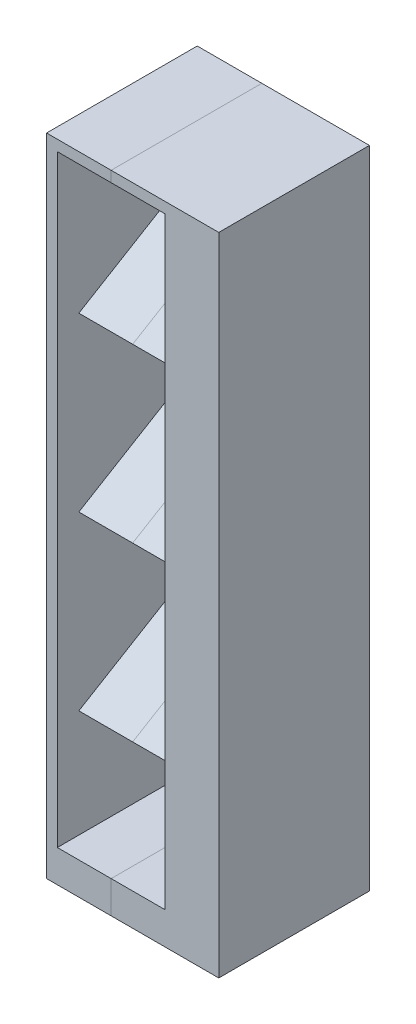
from build123d import *

# Parameters (mm, degrees)
SKETCH2_W           = 40
SKETCH2_H           = 35
BOSS_EXTRUDE1_DEPTH = 150
CAVITY1_START       = -18.497067449
CAVITY1_DEPTH       = 25


# Read off the part's stored shape, not the designer's step: Cavity1
with BuildPart() as part:
    # Sketch2 → Boss-Extrude1 (new body)
    with BuildSketch(Plane(origin=(0, 0, 0), x_dir=(1, 0, 0), z_dir=(0, 1, 0))):
        with Locations((-0.997067449, -7.133431085)):
            Rectangle(SKETCH2_W, SKETCH2_H)
    extrude(amount=BOSS_EXTRUDE1_DEPTH)

    # Cavity1 outline → Cavity1 (cut)
    with BuildSketch(Plane.YZ.offset(CAVITY1_START)):
        Polygon((87.5, -5.366568915), (97.5, -5.366568915), (112.5, 19.633431085), (127.5, -5.366568915), (147.5, -5.366568915), (147.5, 24.633431085), (7.5, 24.633431085), (7.5, -5.366568915), (17.5, -5.366568915), (32.5, 19.633431085), (47.5, -5.366568915), (57.5, -5.366568915), (72.5, 19.633431085), align=None)
    extrude(amount=CAVITY1_DEPTH, mode=Mode.SUBTRACT)


with BuildPart() as body_2:
    # Split1: the piece on the far side of the plane
    add(part.part)
    split(bisect_by=Plane(origin=(-5.997067449, 0, 0), x_dir=(0, 0, 1), z_dir=(1, 0, 0)), keep=Keep.BOTTOM)


with BuildPart() as part_1:
    add(part.part)

    # Split1
    split(bisect_by=Plane(origin=(-5.997067449, 0, 0), x_dir=(0, 0, 1), z_dir=(1, 0, 0)), keep=Keep.TOP)


solid = Compound([body_2.part, part_1.part])
